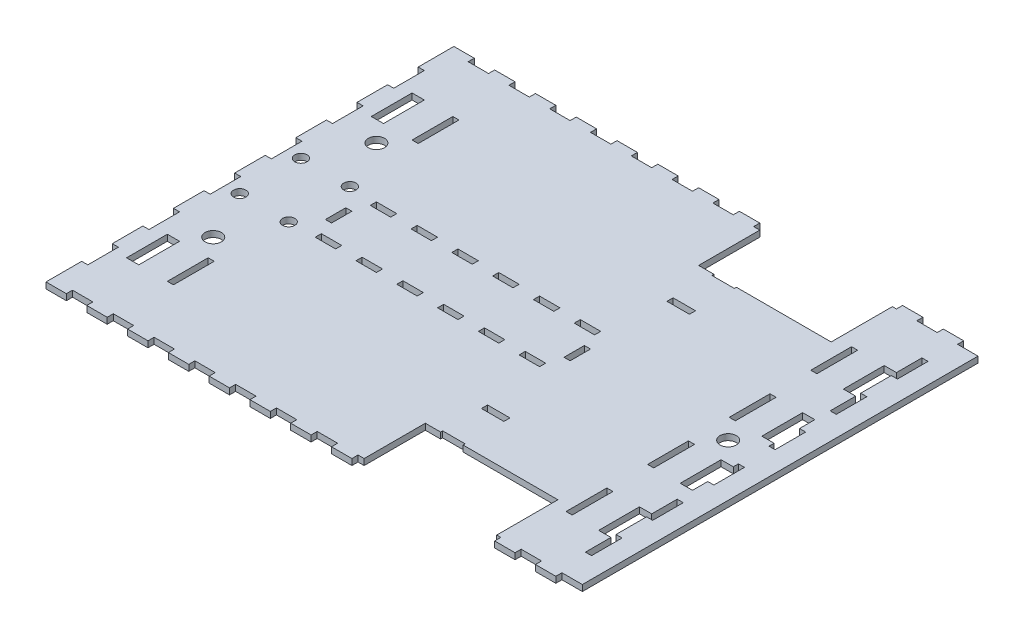
from build123d import *

# Parameters (mm, degrees)
SKETCH3_R             = 3
SKETCH3_W             = 10
SKETCH3_H             = 3
SKETCH3_W_2           = 3
SKETCH3_H_2           = 15
SKETCH3_H_3           = 10
BOSS_EXTRUDE1_DEPTH   = 3
SKETCH5_W             = 11
SKETCH5_H             = 3
CUT_EXTRUDE2_DEPTH    = 10
CROQUIS1_W            = 3
CROQUIS1_H            = 15
CORTAR_EXTRUIR1_DEPTH = 10
CROQUIS2_R            = 4
CROQUIS2_W            = 6
CROQUIS2_H            = 20
CROQUIS2_W_2          = 3
CORTAR_EXTRUIR2_DEPTH = 10


with BuildPart() as part:
    # Sketch3 → Boss-Extrude1 (new body)
    with BuildSketch(Plane(origin=(0, 0, 0), x_dir=(1, 0, 0), z_dir=(0, 1, 0))):
        Polygon((-300, 97), (-300, -97), (-300, -100), (-290, -100), (-290, -97), (-280, -97), (-280, -100), (-270, -100), (-270, -97), (-260, -97), (-260, -100), (-250, -100), (-250, -97), (-240, -97), (-240, -100), (-230, -100), (-230, -97), (-220, -97), (-220, -100), (-210, -100), (-210, -97), (-200, -97), (-200, -100), (-190, -100), (-190, -97), (-180, -97), (-180, -100), (-170, -100), (-170, -97), (-160, -97), (-160, -100), (-150, -100), (-150, -97), (-140, -97), (-140, -100), (-130, -100), (-130, -97), (-120, -97), (-120, -100), (-110, -100), (-110, -97), (-100, -97), (-100, -100), (-90, -100), (-90, -97), (-80, -97), (-80, -100), (-70, -100), (-70, -97), (-60, -97), (-60, -100), (-50, -100), (-50, -97), (-40, -97), (-40, 97), (-50, 97), (-50, 100), (-60, 100), (-60, 97), (-70, 97), (-70, 100), (-80, 100), (-80, 97), (-90, 97), (-90, 100), (-100, 100), (-100, 97), (-110, 97), (-110, 100), (-120, 100), (-120, 97), (-130, 97), (-130, 100), (-140, 100), (-140, 97), (-150, 97), (-150, 100), (-160, 100), (-160, 97), (-170, 97), (-170, 100), (-180, 100), (-180, 97), (-190, 97), (-190, 100), (-200, 100), (-200, 97), (-210, 97), (-210, 100), (-220, 100), (-220, 97), (-230, 97), (-230, 100), (-240, 100), (-240, 97), (-250, 97), (-250, 100), (-260, 100), (-260, 97), (-270, 97), (-270, 100), (-280, 100), (-280, 97), (-290, 97), (-290, 100), (-300, 100), align=None)
        with Locations((-290, -15)):
            Circle(SKETCH3_R, mode=Mode.SUBTRACT)
        with Locations((-266, -15)):
            Circle(SKETCH3_R, mode=Mode.SUBTRACT)
        with Locations((-248, -13.5)):
            Rectangle(SKETCH3_W, SKETCH3_H, mode=Mode.SUBTRACT)
        Polygon((-255, 5), (-255, 0), (-255, -5), (-258, -5), (-258, 0), (-258, 5), align=None, mode=Mode.SUBTRACT)
        with Locations((-228, -13.5)):
            Rectangle(SKETCH3_W, SKETCH3_H, mode=Mode.SUBTRACT)
        with Locations((-208, -13.5)):
            Rectangle(SKETCH3_W, SKETCH3_H, mode=Mode.SUBTRACT)
        with Locations((-188, -13.5)):
            Rectangle(SKETCH3_W, SKETCH3_H, mode=Mode.SUBTRACT)
        with Locations((-51.5, -75)):
            Rectangle(SKETCH3_W_2, SKETCH3_H_2, mode=Mode.SUBTRACT)
        with Locations((-168, -13.5)):
            Rectangle(SKETCH3_W, SKETCH3_H, mode=Mode.SUBTRACT)
        with Locations((-148, -13.5)):
            Rectangle(SKETCH3_W, SKETCH3_H, mode=Mode.SUBTRACT)
        with Locations((-139.5, 0)):
            Rectangle(SKETCH3_W_2, SKETCH3_H_3, mode=Mode.SUBTRACT)
        with Locations((-51.5, -45)):
            Rectangle(SKETCH3_W_2, SKETCH3_H_2, mode=Mode.SUBTRACT)
        with Locations((-51.5, -15)):
            Rectangle(SKETCH3_W_2, SKETCH3_H_2, mode=Mode.SUBTRACT)
        with Locations((-290, 15)):
            Circle(SKETCH3_R, mode=Mode.SUBTRACT)
        with Locations((-266, 15)):
            Circle(SKETCH3_R, mode=Mode.SUBTRACT)
        with Locations((-248, 13.5)):
            Rectangle(SKETCH3_W, SKETCH3_H, mode=Mode.SUBTRACT)
        with Locations((-228, 13.5)):
            Rectangle(SKETCH3_W, SKETCH3_H, mode=Mode.SUBTRACT)
        with Locations((-208, 13.5)):
            Rectangle(SKETCH3_W, SKETCH3_H, mode=Mode.SUBTRACT)
        with Locations((-188, 13.5)):
            Rectangle(SKETCH3_W, SKETCH3_H, mode=Mode.SUBTRACT)
        with Locations((-168, 13.5)):
            Rectangle(SKETCH3_W, SKETCH3_H, mode=Mode.SUBTRACT)
        with Locations((-148, 13.5)):
            Rectangle(SKETCH3_W, SKETCH3_H, mode=Mode.SUBTRACT)
        with Locations((-51.5, 15)):
            Rectangle(SKETCH3_W_2, SKETCH3_H_2, mode=Mode.SUBTRACT)
        with Locations((-51.5, 45)):
            Rectangle(SKETCH3_W_2, SKETCH3_H_2, mode=Mode.SUBTRACT)
        with Locations((-51.5, 75)):
            Rectangle(SKETCH3_W_2, SKETCH3_H_2, mode=Mode.SUBTRACT)
    extrude(amount=BOSS_EXTRUDE1_DEPTH)

    # Sketch5 → Cut-Extrude2 (cut)
    with BuildSketch(Plane(origin=(0, 3, 0), x_dir=(1, 0, 0), z_dir=(0, 1, 0))):
        Polygon((-128.5, 67), (-82, 67), (-82, 97), (-147, 97), (-147, 67), (-139.5, 67), (-139.5, 66), (-128.5, 66), align=None)
        Polygon((-139.5, -67), (-147, -67), (-147, -97), (-82, -97), (-82, -67), (-128.5, -67), (-128.5, -66), (-139.5, -66), align=None)
        with Locations((-134, -45.5)):
            Rectangle(SKETCH5_W, SKETCH5_H)
        with Locations((-134, 45.5)):
            Rectangle(SKETCH5_W, SKETCH5_H)
    extrude(amount=-CUT_EXTRUDE2_DEPTH, mode=Mode.SUBTRACT)


with BuildPart() as cut_extrude2_kept_piece:
    # of the separate pieces the step leaves, the one the design keeps (cut_extrude2_pieces_kept)
    add(part.part.solids().sort_by_distance((-300, 0, -100))[0])

    # Croquis1 → Cortar-Extruir1 (cut)
    with BuildSketch(Plane(origin=(0, 3, 0), x_dir=(1, 0, 0), z_dir=(0, 1, 0))):
        with Locations((-298.5, -75)):
            Rectangle(CROQUIS1_W, CROQUIS1_H)
        with Locations((-298.5, 45)):
            Rectangle(CROQUIS1_W, CROQUIS1_H)
        with Locations((-298.5, 15)):
            Rectangle(CROQUIS1_W, CROQUIS1_H)
        with Locations((-298.5, -15)):
            Rectangle(CROQUIS1_W, CROQUIS1_H)
        with Locations((-298.5, 75)):
            Rectangle(CROQUIS1_W, CROQUIS1_H)
        with Locations((-298.5, -45)):
            Rectangle(CROQUIS1_W, CROQUIS1_H)
    extrude(amount=-CORTAR_EXTRUIR1_DEPTH, mode=Mode.SUBTRACT)

    # Croquis2 → Cortar-Extruir2 (cut)
    with BuildSketch(Plane(origin=(0, 3, 0), x_dir=(1, 0, 0), z_dir=(0, 1, 0))):
        with Locations((-65.5, 0)):
            Circle(CROQUIS2_R)
        with Locations((-278, -40)):
            Circle(CROQUIS2_R)
        with Locations((-278, 40)):
            Circle(CROQUIS2_R)
        with Locations((-56, -20)):
            Rectangle(CROQUIS2_W, CROQUIS2_H)
        with Locations((-56, -60)):
            Rectangle(CROQUIS2_W, CROQUIS2_H)
        with Locations((-56, 60)):
            Rectangle(CROQUIS2_W, CROQUIS2_H)
        with Locations((-56, 20)):
            Rectangle(CROQUIS2_W, CROQUIS2_H)
        with Locations((-73.5, 60)):
            Rectangle(CROQUIS2_W_2, CROQUIS2_H)
        with Locations((-73.5, 20)):
            Rectangle(CROQUIS2_W_2, CROQUIS2_H)
        with Locations((-73.5, -20)):
            Rectangle(CROQUIS2_W_2, CROQUIS2_H)
        with Locations((-73.5, -60)):
            Rectangle(CROQUIS2_W_2, CROQUIS2_H)
        with Locations((-269, -60)):
            Rectangle(CROQUIS2_W_2, CROQUIS2_H)
        with Locations((-269, 60)):
            Rectangle(CROQUIS2_W_2, CROQUIS2_H)
        with Locations((-287.5, 60)):
            Rectangle(CROQUIS2_W, CROQUIS2_H)
        with Locations((-287.5, -60)):
            Rectangle(CROQUIS2_W, CROQUIS2_H)
    extrude(amount=-CORTAR_EXTRUIR2_DEPTH, mode=Mode.SUBTRACT)


solid = cut_extrude2_kept_piece.part
